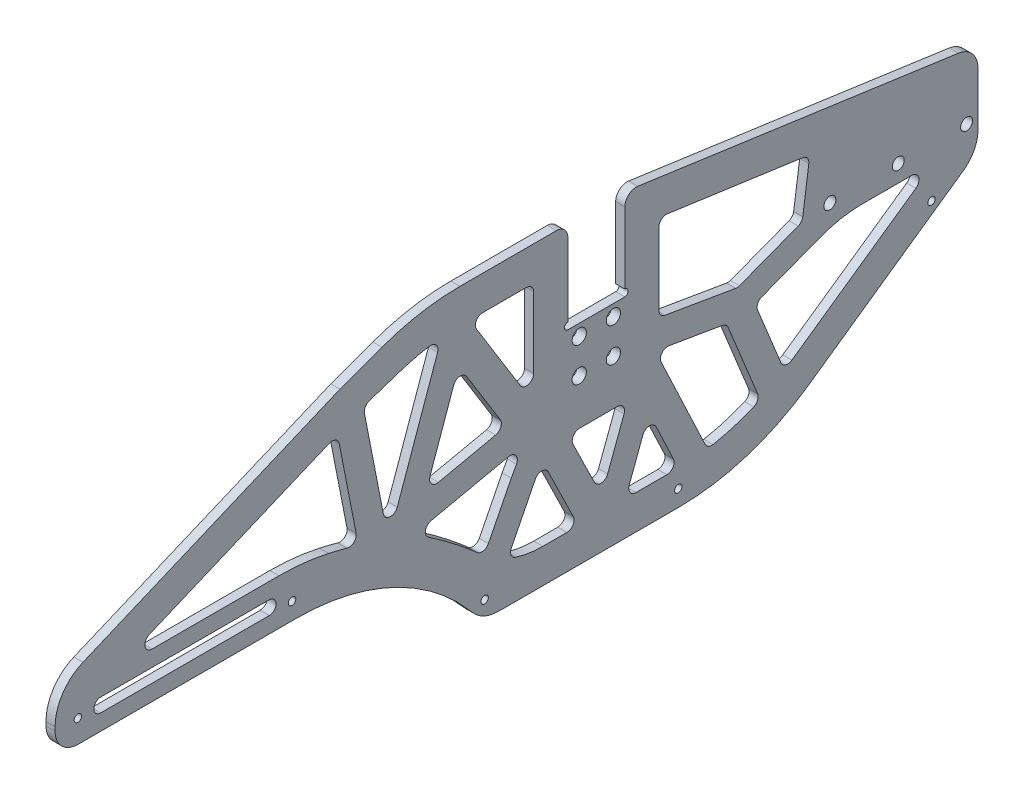
from build123d import *

# Parameters (mm, degrees)
SKETCH2_R               = 3.125
SKETCH2_R_2             = 1.625
BOSS_EXTRUDE1_DEPTH     = 4
SKETCH4_R               = 2.625
CUT_EXTRUDE1_DEPTH      = 4
CUT_EXTRUDE2_DEPTH      = 4
CUT_EXTRUDE3_DEPTH      = 251.422576691
CUT_EXTRUDE3_DEPTH_BACK = 10
FILLET1_START           = -1
FILLET1_DEPTH           = 6
FILLET2_R               = 15
FILLET3_R               = 3.175


with BuildPart() as part:
    # Sketch2 → Boss-Extrude1 (new body)
    with BuildSketch(Plane(origin=(0, 0, 0), x_dir=(0, 0, -1), z_dir=(1, 0, 0))):
        with BuildLine():
            Line((-12.5, 12.5), (12.5, 12.5))
            ThreePointArc((12.5, 12.5), (14, 14), (12.5, 15.5))
            Line((12.5, 15.5), (12.5, 46.748157964))
            ThreePointArc((12.5, 46.748157964), (14.219704855, 50.521705865), (18.195865505, 51.699498308))
            Line((18.195865505, 51.699498308), (158.89173101, 31.92598393))
            ThreePointArc((158.89173101, 31.92598393), (165.047095802, 28.583893533), (167.5, 22.023303243))
            Line((167.5, 22.023303243), (167.5, -9.283829379))
            Line((167.5, -9.283829379), (93.327764747, -61.219787629))
            ThreePointArc((93.327764747, -61.219787629), (66.040701063, -74.676278275), (35.970121112, -79.3045832))
            Line((35.970121112, -79.3045832), (-50.348010792, -79.3045832))
            ThreePointArc((-50.348010792, -79.3045832), (-85.935359672, -48.630118411), (-131.603387734, -37.593207459))
            Line((-131.603387734, -37.593207459), (-227.5, -37.593207459))
            ThreePointArc((-227.5, -37.593207459), (-234.571067812, -34.664275271), (-237.5, -27.593207459))
            Line((-237.5, -27.593207459), (-237.5, -25.880734277))
            ThreePointArc((-237.5, -25.880734277), (-234.158594281, -14.813158364), (-225.250876341, -7.443708597))
            Line((-225.250876341, -7.443708597), (-112.5, 39.956458601))
            Line((-112.5, 39.956458601), (-94.069316262, 46.664678879))
            ThreePointArc((-94.069316262, 46.664678879), (-77.232119696, 51.176192101), (-59.867301929, 52.6954168))
            Line((-59.867301929, 52.6954168), (-17.5, 52.6954168))
            ThreePointArc((-17.5, 52.6954168), (-13.964466094, 51.230950706), (-12.5, 47.6954168))
            Line((-12.5, 47.6954168), (-12.5, 15.5))
            ThreePointArc((-12.5, 15.5), (-14, 14), (-12.5, 12.5))
        make_face()
        with Locations((-7.5, 7.5)):
            Circle(SKETCH2_R, mode=Mode.SUBTRACT)
        with Locations((7.5, 7.5)):
            Circle(SKETCH2_R, mode=Mode.SUBTRACT)
        with Locations((7.5, -7.5)):
            Circle(SKETCH2_R, mode=Mode.SUBTRACT)
        with Locations((-7.5, -7.5)):
            Circle(SKETCH2_R, mode=Mode.SUBTRACT)
        with Locations((-227.5, -27.593207459)):
            Circle(SKETCH2_R_2, mode=Mode.SUBTRACT)
        with Locations((-133.504211585, -30.116786314)):
            Circle(SKETCH2_R_2, mode=Mode.SUBTRACT)
        with Locations((-49.002692564, -71.8045832)):
            Circle(SKETCH2_R_2, mode=Mode.SUBTRACT)
        with Locations((35.970121112, -72.097727652)):
            Circle(SKETCH2_R_2, mode=Mode.SUBTRACT)
        with Locations((147.103987767, -18.332333959)):
            Circle(SKETCH2_R_2, mode=Mode.SUBTRACT)
    extrude(amount=BOSS_EXTRUDE1_DEPTH)

    # Sketch4 → Cut-Extrude1 (cut)
    with BuildSketch(Plane(origin=(4, 0, 0), x_dir=(0, 0, -1), z_dir=(1, 0, 0))):
        with Locations((102.5, 3.216170621)):
            Circle(SKETCH4_R)
        with Locations((162.5, 3.216170621)):
            Circle(SKETCH4_R)
        with Locations((132.5, 3.216170621)):
            Circle(SKETCH4_R)
    extrude(amount=-CUT_EXTRUDE1_DEPTH, mode=Mode.SUBTRACT)

    # Sketch7 → Cut-Extrude2 (cut)
    with BuildSketch(Plane.ZY):
        with BuildLine():
            Line((143.504211585, -24.593207459), (217.5, -24.593207459))
            ThreePointArc((217.5, -24.593207459), (220.5, -27.593207459), (217.5, -30.593207459))
            Line((217.5, -30.593207459), (143.504211585, -30.593207459))
            ThreePointArc((143.504211585, -30.593207459), (140.504211585, -27.593207459), (143.504211585, -24.593207459))
        make_face()
    extrude(amount=-CUT_EXTRUDE2_DEPTH, mode=Mode.SUBTRACT)

    # Sketch8 → Cut-Extrude3 (cut, two sides: drawn at the far end of the back side and taken through both)
    with BuildSketch(Plane(origin=(4, 0, 0), x_dir=(0, 0, -1), z_dir=(1, 0, 0)).offset(-CUT_EXTRUDE3_DEPTH_BACK)):
        with BuildLine():
            Line((-113.57117516, 23.234534385), (-210.688209636, -17.593207459))
            Line((-210.688209636, -17.593207459), (-139.249392001, -17.593207459))
            ThreePointArc((-139.249392001, -17.593207459), (-128.305621954, -18.193841781), (-117.493315985, -19.988529516))
            ThreePointArc((-117.493315985, -19.988529516), (-110.906374998, -21.611191224), (-104.398029564, -23.524895038))
            Line((-104.398029564, -23.524895038), (-113.57117516, 23.234534385))
        make_face()
        with BuildLine():
            ThreePointArc((-38.896111202, -61.219787629), (-31.347289926, -63.525803076), (-23.492615431, -64.3045832))
            Line((-23.492615431, -64.3045832), (-7.844578132, -64.3045832))
            Line((-7.844578132, -64.3045832), (-23.897236503, -31.471478495))
            Line((-23.897236503, -31.471478495), (-38.896111202, -61.219787629))
        make_face()
        with BuildLine():
            Line((82.520271866, -50.475656782), (148.489038099, -4.283829379))
            Line((148.489038099, -4.283829379), (116.676340901, -4.283829379))
            ThreePointArc((116.676340901, -4.283829379), (107.646731671, -5.091144924), (98.911316911, -7.515630477))
            Line((98.911316911, -7.515630477), (69.575731894, -18.680359782))
            Line((69.575731894, -18.680359782), (82.520271866, -50.475656782))
        make_face()
        Polygon((90.339984209, 2.061933427), (93.696000857, 25.941232677), (27.5, 35.244473892), (27.5, -2.831339099), (62.03978176, -8.708743191), align=None)
        Polygon((-27.5, -7.735456644), (-27.5, 37.6954168), (-55.598162704, 37.6954168), align=None)
        with BuildLine():
            Line((-88.939014112, 32.569289567), (-102.31343439, 28.184098276))
            Line((-102.31343439, 28.184098276), (-91.212566173, -28.401754251))
            Line((-91.212566173, -28.401754251), (-67.955274479, 37.309745965))
            ThreePointArc((-67.955274479, 37.309745965), (-78.597719011, 35.60604022), (-88.939014112, 32.569289567))
        make_face()
        Polygon((13.776543649, -27.5), (-12.481500104, -27.5), (2.390501596, -57.918263299), align=None)
        Polygon((-74.89478187, -18.263165558), (-39.778603589, -10.696041624), (-60.41005824, 22.662189485), align=None)
        with BuildLine():
            Line((-49.181599521, -54.965243604), (-37.325171166, -31.449566394))
            Line((-37.325171166, -31.449566394), (-31.703807854, -21.231467759))
            Line((-31.703807854, -21.231467759), (-79.948761535, -31.627688578))
            ThreePointArc((-79.948761535, -31.627688578), (-66.849258357, -40.525120988), (-54.439866562, -50.362208069))
            Line((-54.439866562, -50.362208069), (-50.683815172, -53.641226781))
            ThreePointArc((-50.683815172, -53.641226781), (-49.940993749, -54.312636858), (-49.181599521, -54.965243604))
        make_face()
        Polygon((23.060748964, -36.927651205), (12.81312582, -64.3045832), (35.970121112, -64.3045832), align=None)
        with BuildLine():
            Line((25.857837049, -14.724396782), (48.779257286, -63.333899694))
            ThreePointArc((48.779257286, -63.333899694), (60.611766088, -60.654379345), (71.942273955, -56.317596515))
            Line((71.942273955, -56.317596515), (57.178612381, -20.054044039))
            Line((57.178612381, -20.054044039), (25.857837049, -14.724396782))
        make_face()
    extrude(amount=CUT_EXTRUDE3_DEPTH + CUT_EXTRUDE3_DEPTH_BACK, mode=Mode.SUBTRACT)

    # Fillet1: read off the stored shape, not the designer's step
    # Fillet1 outline → Fillet1 (cut)
    with BuildSketch(Plane.YZ.offset(FILLET1_START)):
        with BuildLine():
            Line((-79.3045832, 50.348010792), (-79.3045832, 40.658946938))
            add(Edge.make_bspline(
                [(-79.3045832, 40.658946938), (-79.3045832, 42.329655762), (-79.3045832, 44.000364586), (-78.966879258, 47.665805706), (-77.514803195, 50.954845241), (-74.76186007, 53.781947885), (-73.525620436, 54.806645775), (-72.352687243, 55.816353737)],
                knots=[0, 0, 0, 0, 0, 0, 0.5, 0.5, 1, 1, 1, 1, 1, 1], degree=5))
            ThreePointArc((-72.352687243, 55.816353737), (-75.76814719, 53.005283923), (-79.3045832, 50.348010792))
        make_face()
    extrude(amount=FILLET1_DEPTH, mode=Mode.SUBTRACT)

    # Fillet2
    fillet2_edges = [part.edges().sort_by_distance(p)[0] for p in [
        (2, -9.283829379, -167.5),
    ]]
    fillet(fillet2_edges, radius=FILLET2_R)

    # Fillet3
    fillet3_edges = [part.edges().sort_by_distance(p)[0] for p in [
        (2, -17.593207459, 210.688209636),
        (2, 37.309745965, 67.955274479),
        (2, -7.735456644, 27.5),
        (2, 37.6954168, 55.598162704),
        (2, 37.6954168, 27.5),
        (2, -18.263165558, 74.89478187),
        (2, -31.627688578, 79.948761535),
        (2, -21.231467759, 31.703807854),
        (2, -54.965243604, 49.181599521),
        (2, -61.219787629, 38.896111202),
        (2, -64.3045832, 7.844578132),
        (2, -31.471478495, 23.897236503),
        (2, -57.918263299, -2.390501596),
        (2, -27.5, -13.776543649),
        (2, -27.5, 12.481500104),
        (2, -64.3045832, -12.81312582),
        (2, -36.927651205, -23.060748964),
        (2, -64.3045832, -35.970121112),
        (2, -14.724396782, -25.857837049),
        (2, -20.054044039, -57.178612381),
        (2, -63.333899694, -48.779257286),
        (2, -56.317596515, -71.942273955),
        (2, -50.475656782, -82.520271866),
        (2, -4.283829379, -148.489038099),
        (2, -18.680359782, -69.575731894),
        (2, -2.831339099, -27.5),
        (2, -8.708743191, -62.03978176),
        (2, 2.061933427, -90.339984209),
        (2, 25.941232677, -93.696000857),
        (2, 35.244473892, -27.5),
        (2, -10.696041624, 39.778603589),
        (2, -28.401754251, 91.212566173),
        (2, 28.184098276, 102.31343439),
        (2, 22.662189485, 60.41005824),
        (2, -23.524895038, 104.398029564),
        (2, 23.234534385, 113.57117516),
    ]]
    fillet(fillet3_edges, radius=FILLET3_R)


solid = part.part
